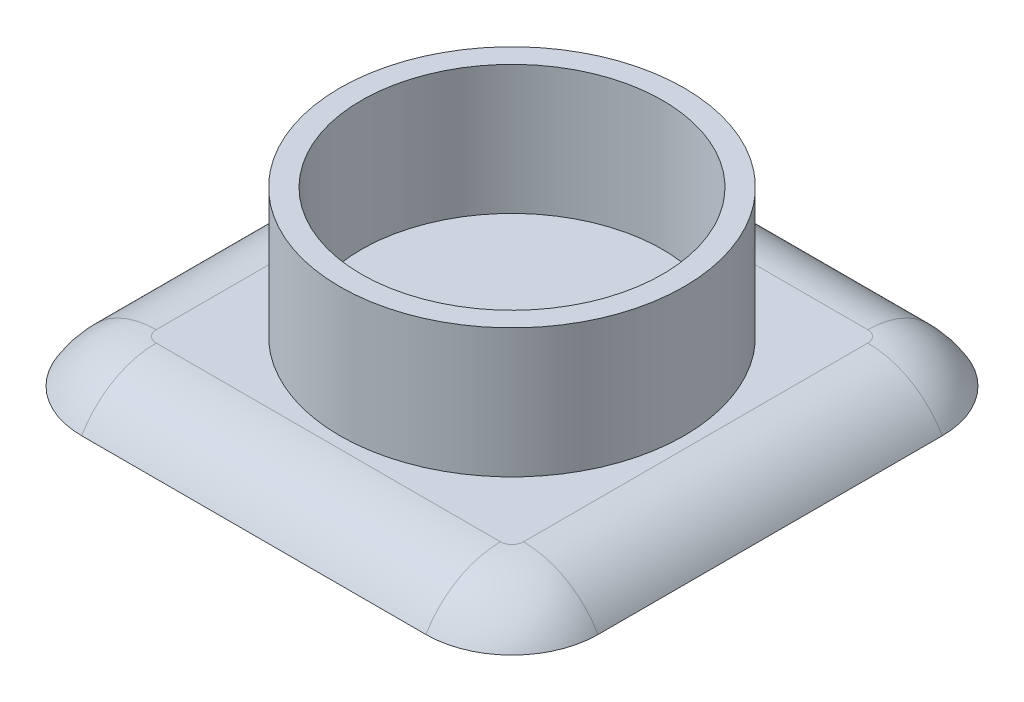
from build123d import *

# Parameters (mm, degrees)
SKETCH1_R           = 4
SKETCH1_R_2         = 3.5
BOSS_EXTRUDE1_DEPTH = 3
SKETCH2_W           = 12
SKETCH2_H           = 12
BOSS_EXTRUDE2_DEPTH = 1
FILLET10_R          = 2
FILLET11_R          = 2


with BuildPart() as part:
    # Sketch1 → Boss-Extrude1 (new body)
    with BuildSketch(Plane(origin=(0, 0, 0), x_dir=(1, 0, 0), z_dir=(0, 1, 0))):
        with Locations(Location((0, 0, 0), (0, 0, 270))):
            Circle(SKETCH1_R)
        with Locations(Location((0, 0, 0), (0, 0, 270))):
            Circle(SKETCH1_R_2, mode=Mode.SUBTRACT)
    extrude(amount=BOSS_EXTRUDE1_DEPTH)

    # Sketch2 → Boss-Extrude2 (add)
    with BuildSketch(Plane.XZ):
        Rectangle(SKETCH2_W, SKETCH2_H)
    extrude(amount=BOSS_EXTRUDE2_DEPTH)

    # Fillet10
    fillet10_edges = [part.edges().sort_by_distance(p)[0] for p in [
        (6, -0.5, -6),
        (6, -0.5, 6),
        (-6, -0.5, 6),
        (-6, -0.5, -6),
    ]]
    fillet(fillet10_edges, radius=FILLET10_R)

    # Fillet11
    # the kernel refuses this fillet: 2 mm, written as the material it takes off along each edge
    with BuildSketch(Plane(origin=(-4, 0, 4), x_dir=(0, 0, 1), z_dir=(1, 0, 0))) as fillet11_piece_1:
        with BuildLine():
            CenterArc((0.267949192, 2), FILLET11_R, 270, 60)
            Line((2, 1), (2.034641016, 0.98))
            ThreePointArc((2.034641016, 0.98), (2.04, 0.5), (2.04, 0))
            Line((2.04, 0), (2, -0.04))
            Line((2, -0.04), (0.267949192, -0.04))
            Line((0.267949192, -0.04), (0.267949192, 0))
        make_face()
    revolve(axis=Axis((-4, 0, 4), (0, -1, 0)), revolution_arc=90, mode=Mode.SUBTRACT)
    with BuildSketch(Plane(origin=(-4, 0, 6), x_dir=(0, -1, 0), z_dir=(1, 0, 0))) as fillet11_piece_2:
        with BuildLine():
            CenterArc((2, 1.732050808), FILLET11_R, 180, 60)
            Line((0, 1.732050808), (-0.04, 1.732050808))
            Line((-0.04, 1.732050808), (-0.04, 0))
            Line((-0.04, 0), (0, -0.04))
            ThreePointArc((0, -0.04), (0.5, -0.04), (0.98, -0.034641016))
            Line((0.98, -0.034641016), (1, 0))
        make_face()
    extrude(amount=8, mode=Mode.SUBTRACT)
    with BuildSketch(Plane(origin=(4, 0, 4), x_dir=(0, 0, 1), z_dir=(-1, 0, 0))) as fillet11_piece_3:
        with BuildLine():
            CenterArc((0.267949192, -2), FILLET11_R, 30, 60)
            Line((2, -1), (2.034641016, -0.98))
            ThreePointArc((2.034641016, -0.98), (2.04, -0.5), (2.04, 0))
            Line((2.04, 0), (2, 0.04))
            Line((2, 0.04), (0.267949192, 0.04))
            Line((0.267949192, 0.04), (0.267949192, 0))
        make_face()
    revolve(axis=Axis((4, 0, 4), (0, 1, 0)), revolution_arc=90, mode=Mode.SUBTRACT)
    with BuildSketch(Plane(origin=(4, 0, -4), x_dir=(1, 0, 0), z_dir=(0, 0, 1))) as fillet11_piece_4:
        with BuildLine():
            CenterArc((0.267949192, -2), FILLET11_R, 30, 60)
            Line((2, -1), (2.034641016, -0.98))
            ThreePointArc((2.034641016, -0.98), (2.04, -0.5), (2.04, 0))
            Line((2.04, 0), (2, 0.04))
            Line((2, 0.04), (0.267949192, 0.04))
            Line((0.267949192, 0.04), (0.267949192, 0))
        make_face()
    revolve(axis=Axis((4, 0, -4), (0, 1, 0)), revolution_arc=90, mode=Mode.SUBTRACT)
    with BuildSketch(Plane(origin=(4, 0, -6), x_dir=(0, 0, 1), z_dir=(-1, 0, 0)), Plane(origin=(6, 0, 4), x_dir=(-1, 0, 0), z_dir=(0, 0, -1)), Plane(origin=(-6, 0, -4), x_dir=(1, 0, 0), z_dir=(0, 0, 1))) as fillet11_piece_5:
        with BuildLine():
            CenterArc((1.732050808, -2), FILLET11_R, 90, 60)
            Line((0, -1), (-0.034641016, -0.98))
            ThreePointArc((-0.034641016, -0.98), (-0.04, -0.5), (-0.04, 0))
            Line((-0.04, 0), (0, 0.04))
            Line((0, 0.04), (1.732050808, 0.04))
            Line((1.732050808, 0.04), (1.732050808, 0))
        make_face()
    extrude(amount=8, mode=Mode.SUBTRACT)
    with BuildSketch(Plane(origin=(-4, 0, -4), x_dir=(-1, 0, 0), z_dir=(0, 0, 1))) as fillet11_piece_6:
        with BuildLine():
            CenterArc((0.267949192, 2), FILLET11_R, 270, 60)
            Line((2, 1), (2.034641016, 0.98))
            ThreePointArc((2.034641016, 0.98), (2.04, 0.5), (2.04, 0))
            Line((2.04, 0), (2, -0.04))
            Line((2, -0.04), (0.267949192, -0.04))
            Line((0.267949192, -0.04), (0.267949192, 0))
        make_face()
    revolve(axis=Axis((-4, 0, -4), (0, -1, 0)), revolution_arc=90, mode=Mode.SUBTRACT)


solid = part.part
